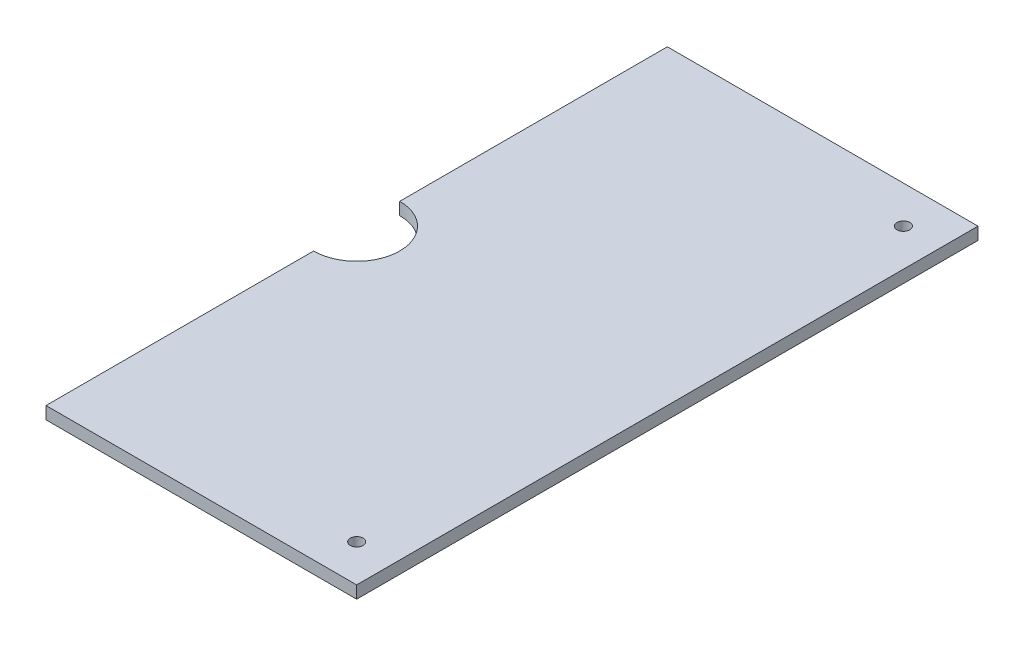
from build123d import *

# Parameters (mm, degrees)
SKETCH1_R           = 1.63195
BOSS_EXTRUDE1_DEPTH = 3.175


with BuildPart() as part:
    # Sketch1 → Boss-Extrude1 (new body)
    with BuildSketch(Plane(origin=(0, 0, 0), x_dir=(1, 0, 0), z_dir=(0, 1, 0))):
        with BuildLine():
            Line((0, -11), (0, -79.375))
            Line((0, -79.375), (79.37, -79.375))
            Line((79.37, -79.375), (79.37, 79.375))
            Line((79.37, 79.375), (0, 79.375))
            Line((0, 79.375), (0, 11))
            ThreePointArc((0, 11), (11, 0), (0, -11))
        make_face()
        with Locations((69.84, 69.845)):
            Circle(SKETCH1_R, mode=Mode.SUBTRACT)
        with Locations((69.84, -69.845)):
            Circle(SKETCH1_R, mode=Mode.SUBTRACT)
    extrude(amount=BOSS_EXTRUDE1_DEPTH)


solid = part.part
